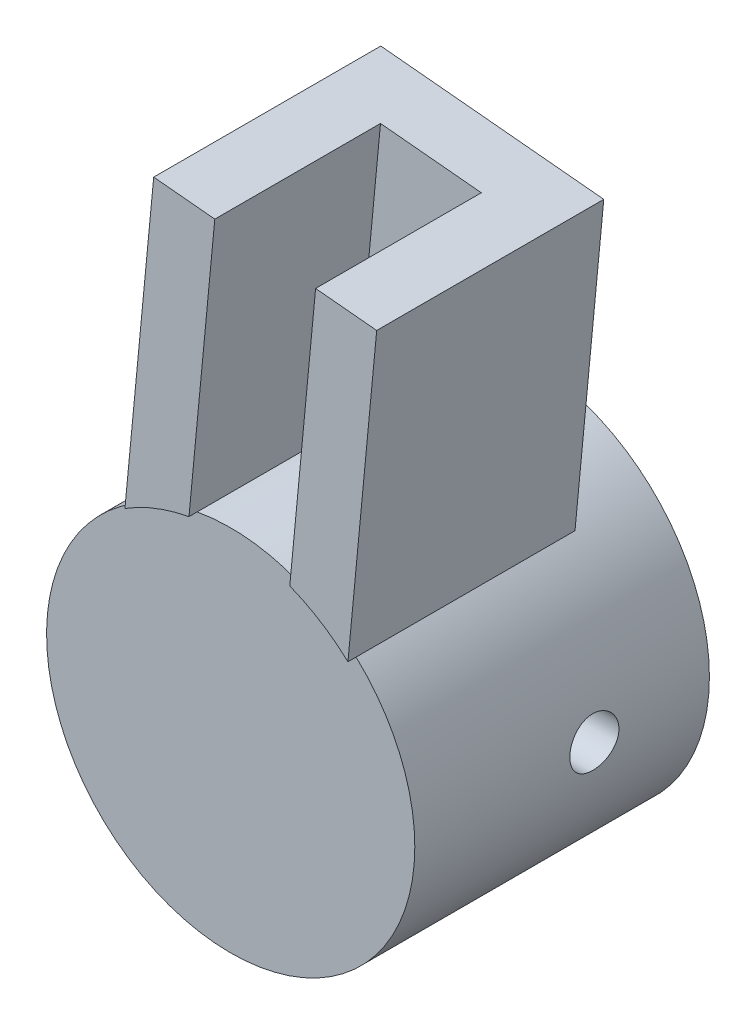
from build123d import *

# Parameters (mm, degrees)
SKETCH2_R                       = 12
BOSS_EXTRUDE1_DEPTH             = 15
BOSS_EXTRUDE2_START             = 4.2
SKETCH2_2_R                     = 12
BOSS_EXTRUDE2_DEPTH             = 4.2
BOSS_EXTRUDE3_REACH             = 35.003
BOSS_EXTRUDE3_END_RADIUS        = 12
BOSS_EXTRUDE3_DIRECTION_2_DEPTH = 15
SKETCH7_R                       = 1.6
CUT_EXTRUDE2_DEPTH              = 36.467279639


with BuildPart() as part:
    # Sketch2 → Boss-Extrude1 (new body)
    with BuildSketch(Plane.XY):
        Circle(SKETCH2_R)
        with BuildLine():
            Line((2.342102698, -1.246891811), (2.378059506, -0.870248806))
            Line((2.378059506, -0.870248806), (2.499763008, 0.404579911))
            Line((2.499763008, 0.404579911), (2.535719817, 0.781222917))
            ThreePointArc((2.535719817, 0.781222917), (2.605378313, 0.992063578), (2.759464317, 1.151949768))
            ThreePointArc((2.759464317, 1.151949768), (2.885657272, 1.477450584), (2.618343606, 1.701991998))
            ThreePointArc((2.618343606, 1.701991998), (2.426957371, 1.756617526), (2.272042895, 1.881574097))
            ThreePointArc((2.272042895, 1.881574097), (-2.936648248, 0.280351681), (1.874992603, -2.277477275))
            ThreePointArc((1.874992603, -2.277477275), (2.050751711, -2.184088971), (2.249016542, -2.166662086))
            ThreePointArc((2.249016542, -2.166662086), (2.553986879, -1.996754653), (2.49166094, -1.653256588))
            ThreePointArc((2.49166094, -1.653256588), (2.370610062, -1.467104029), (2.342102698, -1.246891811))
        make_face(mode=Mode.SUBTRACT)
    extrude(amount=-BOSS_EXTRUDE1_DEPTH)

    # Sketch2<2> → Boss-Extrude2 (add)
    with BuildSketch(Plane.XY.offset(BOSS_EXTRUDE2_START)):
        Circle(SKETCH2_2_R)
    extrude(amount=-BOSS_EXTRUDE2_DEPTH)

    # Boss-Extrude3: up to this cylinder (the profile starts outside it)
    boss_extrude3_end = Plane(origin=(0, 0, -2.668883), z_dir=(0, 0, 1)) * Cylinder(BOSS_EXTRUDE3_END_RADIUS, 95.006, mode=Mode.PRIVATE)
    # Sketch4 → Boss-Extrude3 (add, up to the surface)
    with BuildSketch(Plane(origin=(1.354578049, 14.189032993, 0), x_dir=(0.9954739825045908, -0.09503446825467889, 0), z_dir=(-0.09503446825467889, -0.9954739825045908, 0)), mode=Mode.PRIVATE) as boss_extrude3_sk1:
        Polygon((7.3, 4.731117122), (7.3, -10.068882878), (-0.00048092, -10.068882878), (-7.3, -10.068882878), (-7.3, 4.731117122), (-3.3, 4.731117122), (-3.3, -6.068882878), (3.3, -6.068882878), (3.3, 4.731117122), align=None)
    boss_extrude3_tool1 = extrude(boss_extrude3_sk1.sketch, amount=BOSS_EXTRUDE3_REACH, mode=Mode.PRIVATE) - boss_extrude3_end
    add(boss_extrude3_tool1.solids().sort_by_distance((8.414585, 13.515038, -2.668883))[0])

    # Sketch4 → Boss-Extrude3 direction 2 (add)
    with BuildSketch(Plane(origin=(1.354578049, 14.189032993, 0), x_dir=(0.9954739825045908, -0.09503446825467889, 0), z_dir=(-0.09503446825467889, -0.9954739825045908, 0))):
        Polygon((7.3, 4.731117122), (7.3, -10.068882878), (-0.00048092, -10.068882878), (-7.3, -10.068882878), (-7.3, 4.731117122), (-3.3, 4.731117122), (-3.3, -6.068882878), (3.3, -6.068882878), (3.3, 4.731117122), align=None)
    extrude(amount=-BOSS_EXTRUDE3_DIRECTION_2_DEPTH)

    # Sketch7 → Cut-Extrude2 (cut, through all)
    with BuildSketch(Plane(origin=(0, 0, 0), x_dir=(0, 0, -1), z_dir=(1, 0, 0))):
        with Locations((7.503688218, 0)):
            Circle(SKETCH7_R)
    extrude(amount=CUT_EXTRUDE2_DEPTH, mode=Mode.SUBTRACT)


solid = part.part
